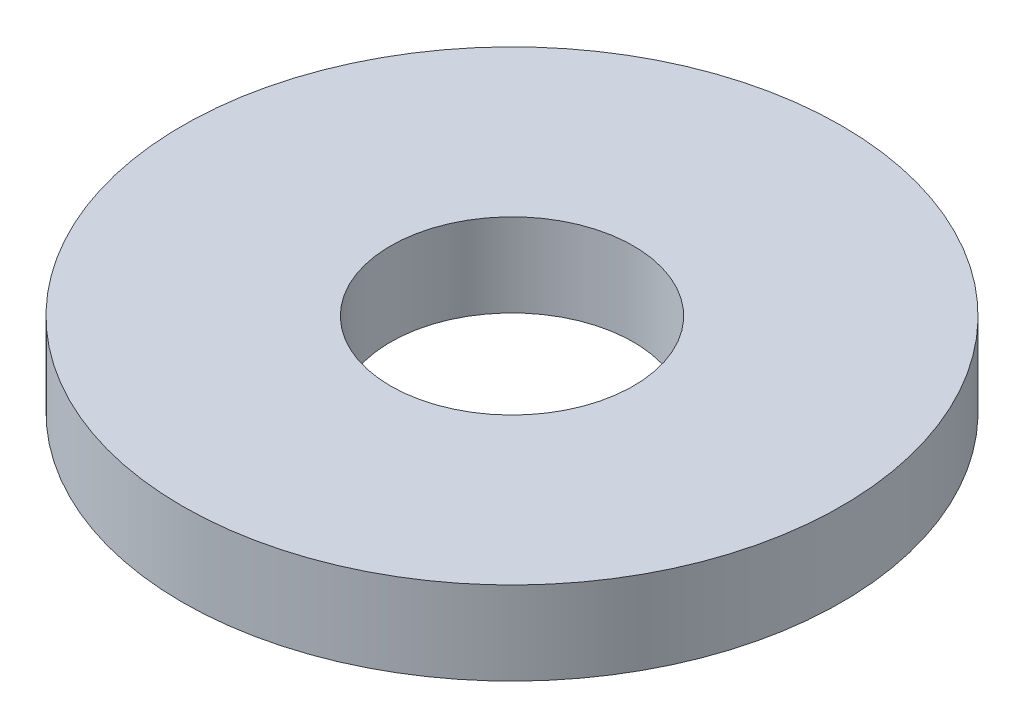
from build123d import *

# Parameters (mm, degrees)
SKETCH1_R           = 95
BOSS_EXTRUDE1_DEPTH = 24
SKETCH2_R           = 35
CUT_EXTRUDE1_DEPTH  = 137.477104307


with BuildPart() as part:
    # Sketch1 → Boss-Extrude1 (new body)
    with BuildSketch(Plane(origin=(0, 0, 0), x_dir=(1, 0, 0), z_dir=(0, 1, 0))):
        Circle(SKETCH1_R)
    extrude(amount=BOSS_EXTRUDE1_DEPTH)

    # Sketch2 → Cut-Extrude1 (cut, through all)
    with BuildSketch(Plane(origin=(0, 0, 0), x_dir=(1, 0, 0), z_dir=(0, 1, 0))):
        Circle(SKETCH2_R)
    extrude(amount=CUT_EXTRUDE1_DEPTH, mode=Mode.SUBTRACT)


solid = part.part
